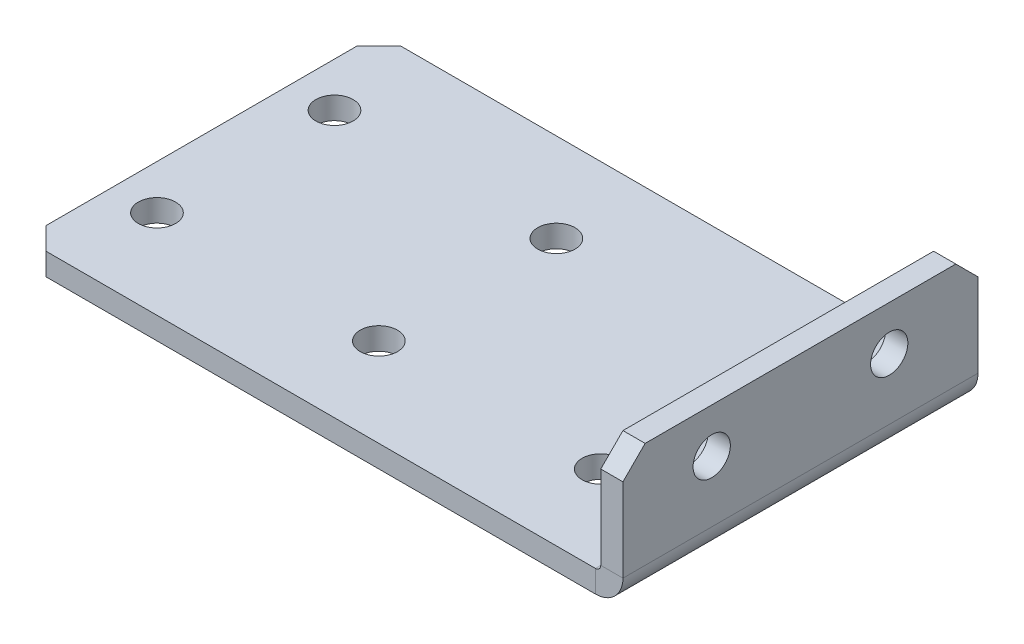
from build123d import *

# Parameters (mm, degrees)
BOSS_EXTRUDE1_DEPTH        = 3.175
F_10_CLEARANCE_HOLE1_D     = 5.334
F_10_CLEARANCE_HOLE2_D     = 5.334
SKETCHED_START             = 85.725
SKETCHED_BEND1_OUTLINE_W   = 3.175
SKETCHED_BEND1_OUTLINE_H   = 50.8
SKETCHED_BEND1_DEPTH       = 14.86658597
SKETCHED_START_2           = 82.55
SKETCHED_BEND1_2_OUTLINE_R = 2.667
SKETCHED_BEND1_2_DEPTH     = 2.79208738
SKETCHED_START_3           = 81.788
SKETCHED_BEND1_3_OUTLINE_R = 2.667
SKETCHED_BEND1_3_DEPTH     = 3.937
SKETCHED_START_4           = -63.5
SKETCHED_BEND1_4_DEPTH     = 51.5


with BuildPart() as part:
    # Sketch11 → Boss-Extrude1 (new body)
    with BuildSketch(Plane.XZ):
        Polygon((97.41658597, -12.7), (3.175, -12.7), (0, -15.875), (0, -60.325), (3.175, -63.5), (97.41658597, -63.5), (100.59158597, -60.325), (100.59158597, -15.875), align=None)
    extrude(amount=-BOSS_EXTRUDE1_DEPTH)

    # #10 Clearance Hole1 (through all)
    with Locations(Plane(origin=(0, 3.175, 0), x_dir=(1, 0, 0), z_dir=(0, 1, 0))):
        with Locations((94.24158597, 25.4), (94.24158597, 50.8)):
            Hole(F_10_CLEARANCE_HOLE1_D / 2)

    # #10 Clearance Hole2 (through all)
    with Locations(Plane(origin=(0, 0, 0), x_dir=(-1, 0, 0), z_dir=(0, -1, 0))):
        with Locations((-38.1, 25.4), (-38.1, 50.8), (-69.85, 25.4), (-69.85, 50.8), (-6.35, 25.4), (-6.35, 50.8)):
            Hole(F_10_CLEARANCE_HOLE2_D / 2)

    # Sketched Bend1: read off the stored shape, not the designer's step
    # Sketched Bend1 outline → Sketched Bend1 (cut)
    with BuildSketch(Plane.YZ.offset(SKETCHED_START)):
        with Locations((1.5875, -38.1)):
            Rectangle(SKETCHED_BEND1_OUTLINE_W, SKETCHED_BEND1_OUTLINE_H)
    extrude(amount=SKETCHED_BEND1_DEPTH, mode=Mode.SUBTRACT)

    # Sketched Bend1 2 outline → Sketched Bend1 2 (add)
    with BuildSketch(Plane.YZ.offset(SKETCHED_START_2)):
        Polygon((19.05, -60.325), (19.05, -15.875), (15.875, -12.7), (3.175, -12.7), (3.175, -63.5), (15.875, -63.5), align=None)
        with Locations((12.7, -50.8)):
            Circle(SKETCHED_BEND1_2_OUTLINE_R, mode=Mode.SUBTRACT)
        with Locations((12.7, -25.4)):
            Circle(SKETCHED_BEND1_2_OUTLINE_R, mode=Mode.SUBTRACT)
    extrude(amount=SKETCHED_BEND1_2_DEPTH)

    # Sketched Bend1 3 outline → Sketched Bend1 3 (add)
    with BuildSketch(Plane.YZ.offset(SKETCHED_START_3)):
        Polygon((19.05, -60.325), (19.05, -15.875), (15.875, -12.7), (3.175, -12.7), (3.175, -63.5), (15.875, -63.5), align=None)
        with Locations((12.7, -50.8)):
            Circle(SKETCHED_BEND1_3_OUTLINE_R, mode=Mode.SUBTRACT)
        with Locations((12.7, -25.4)):
            Circle(SKETCHED_BEND1_3_OUTLINE_R, mode=Mode.SUBTRACT)
    extrude(amount=SKETCHED_BEND1_3_DEPTH)

    # Sketched Bend1 4 outline → Sketched Bend1 4 (cut)
    with BuildSketch(Plane.XY.offset(SKETCHED_START_4)):
        with BuildLine():
            ThreePointArc((81.788, 3.175), (82.326815367, 3.398184633), (82.55, 3.937))
            Line((82.55, 3.937), (82.55, 19.05))
            Line((82.55, 19.05), (81.788, 19.05))
            Line((81.788, 19.05), (81.788, 3.175))
        make_face()
        with BuildLine():
            Line((85.725, 0), (85.725, 3.937))
            ThreePointArc((85.725, 3.937), (84.571879398, 1.153120602), (81.788, 0))
            Line((81.788, 0), (85.725, 0))
        make_face()
    extrude(amount=SKETCHED_BEND1_4_DEPTH, mode=Mode.SUBTRACT)


solid = part.part
